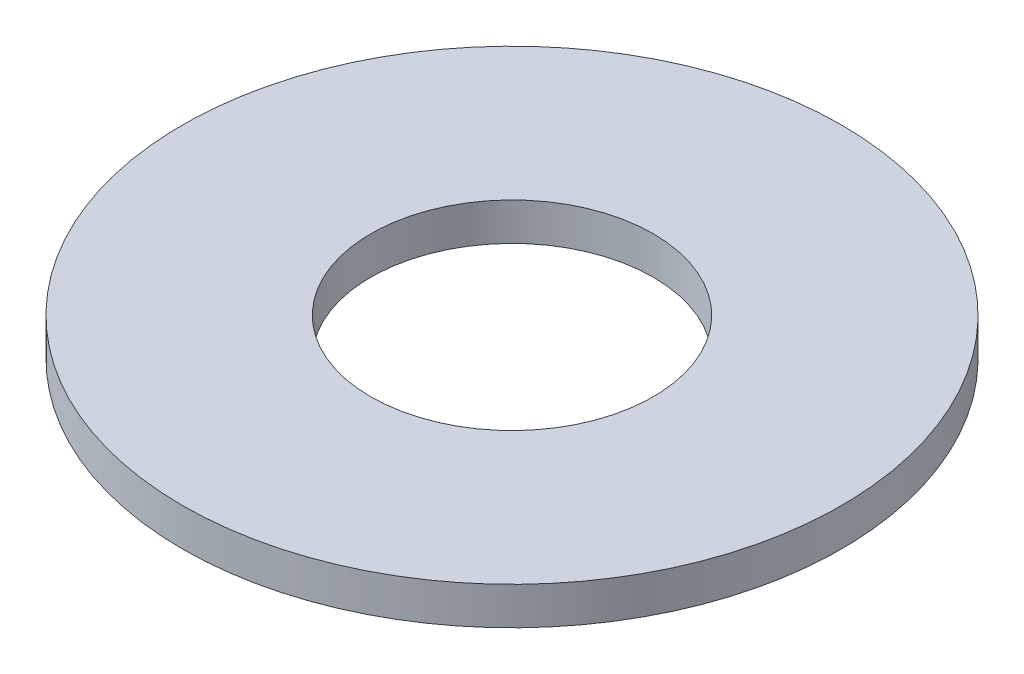
from build123d import *

# Parameters (mm, degrees)
SKETCH1_R           = 3.5
SKETCH1_R_2         = 1.5
BOSS_EXTRUDE1_DEPTH = 0.4


with BuildPart() as part:
    # Sketch1 → Boss-Extrude1 (new body)
    with BuildSketch(Plane(origin=(0, 0, 0), x_dir=(1, 0, 0), z_dir=(0, 1, 0))):
        Circle(SKETCH1_R)
        Circle(SKETCH1_R_2, mode=Mode.SUBTRACT)
    extrude(amount=BOSS_EXTRUDE1_DEPTH)


solid = part.part
